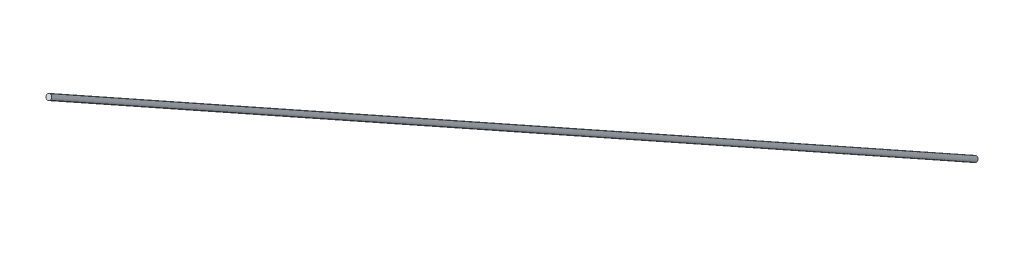
from build123d import *

# Parameters (mm, degrees)
SWEEP1_PROFILE_R = 0.79375


with BuildPart() as part:
    # Sweep1: sweep along a curve in space
    with BuildLine() as sweep1_path:
        Line((285.474604576, 350.615166874, -782.773583612), (285.474604576, 189.720208784, -1071.122074957))
    # Sweep1 profile (on start of the path) → Sweep1 (sweep)
    with BuildSketch(Plane(origin=(285.474604576, 350.615166874, -782.773583612), x_dir=(0, -0.8732540622216938, 0.4872651668376371), z_dir=(0, -0.4872651668376371, -0.8732540622216938))):
        Circle(SWEEP1_PROFILE_R)
    sweep(path=sweep1_path.line)


solid = part.part
